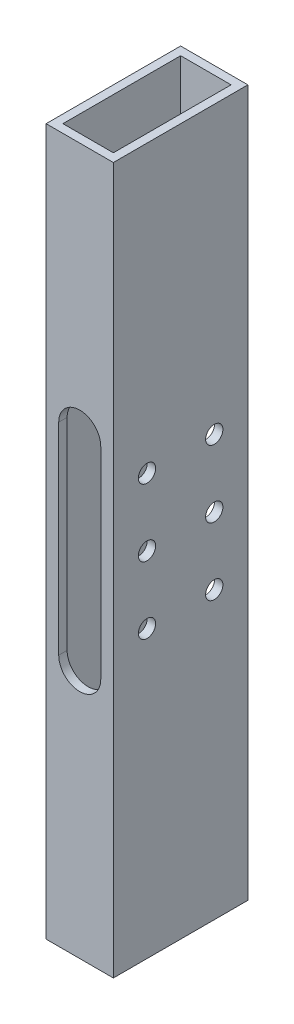
from build123d import *

# Parameters (mm, degrees)
SKETCH1_W           = 25.4
SKETCH1_H           = 50.8
SKETCH1_W_2         = 19.05
SKETCH1_H_2         = 44.45
BOSS_EXTRUDE1_DEPTH = 266.7
SKETCH2_R           = 3.2639
CUT_EXTRUDE1_DEPTH  = 3.175
CUT_EXTRUDE2_DEPTH  = 272.7918689


with BuildPart() as part:
    # Sketch1 → Boss-Extrude1 (new body)
    with BuildSketch(Plane(origin=(0, 0, 0), x_dir=(1, 0, 0), z_dir=(0, 1, 0))):
        Rectangle(SKETCH1_W, SKETCH1_H)
        Rectangle(SKETCH1_W_2, SKETCH1_H_2, mode=Mode.SUBTRACT)
    extrude(amount=BOSS_EXTRUDE1_DEPTH)

    # Sketch2 → Cut-Extrude1 (cut)
    with BuildSketch(Plane(origin=(12.7, 0, 0), x_dir=(0, 0, -1), z_dir=(1, 0, 0))):
        with Locations((-12.7, 158.75)):
            Circle(SKETCH2_R)
        with Locations((12.7, 158.75)):
            Circle(SKETCH2_R)
        with Locations((12.7, 133.35)):
            Circle(SKETCH2_R)
        with Locations((12.7, 107.95)):
            Circle(SKETCH2_R)
        with Locations((-12.7, 133.35)):
            Circle(SKETCH2_R)
        with Locations((-12.7, 107.95)):
            Circle(SKETCH2_R)
    extrude(amount=-CUT_EXTRUDE1_DEPTH, mode=Mode.SUBTRACT)

    # Sketch3 → Cut-Extrude2 (cut, through all)
    with BuildSketch(Plane.XY.offset(25.4)):
        with BuildLine():
            Line((-7.9375, 95.25), (-7.9375, 171.45))
            ThreePointArc((-7.9375, 171.45), (0, 179.3875), (7.9375, 171.45))
            Line((7.9375, 171.45), (7.9375, 95.25))
            ThreePointArc((7.9375, 95.25), (0, 87.3125), (-7.9375, 95.25))
        make_face()
    extrude(amount=-CUT_EXTRUDE2_DEPTH, mode=Mode.SUBTRACT)


solid = part.part
